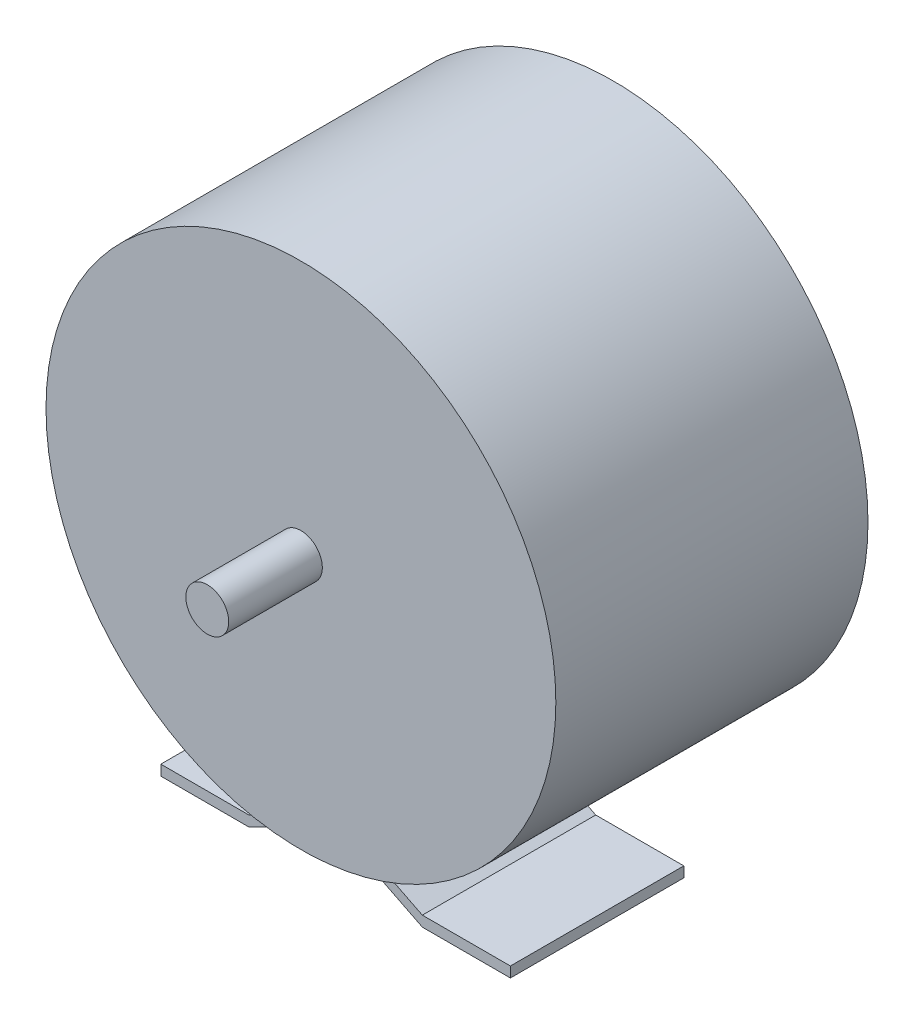
from build123d import *

# Parameters (mm, degrees)
SKETCH1_R           = 73.5
BOSS_EXTRUDE1_DEPTH = 90
SKETCH2_R           = 6.175
BOSS_EXTRUDE2_DEPTH = 27
BOSS_EXTRUDE3_DEPTH = 50
SHELL1_START        = 8
SHELL1_OUTLINE_R    = 65.5
SHELL1_DEPTH        = 74


# Read off the part's stored shape, not the designer's step: Shell1
with BuildPart() as part:
    # Sketch1 → Boss-Extrude1 (new body)
    with BuildSketch(Plane.XY):
        with Locations(Location((0, 0, 0), (0, 0, 180))):
            Circle(SKETCH1_R)
    extrude(amount=BOSS_EXTRUDE1_DEPTH)

    # Sketch2 → Boss-Extrude2 (add)
    with BuildSketch(Plane.XY.offset(90)):
        Circle(SKETCH2_R)
    extrude(amount=BOSS_EXTRUDE2_DEPTH)

    # Sketch3 → Boss-Extrude3 (add)
    with BuildSketch(Plane.XY.offset(80)):
        Polygon((-50.4, -85.345), (-25, -85.345), (-6.35, -76), (0, -76), (0, -73), (-6.35, -73), (-25, -82.345), (-50.4, -82.345), align=None)
    boss_extrude3 = extrude(amount=-BOSS_EXTRUDE3_DEPTH)

    # Mirror1: Boss-Extrude3 across plane
    add(boss_extrude3.mirror(Plane(origin=(0, 0, 0), x_dir=(0, 0, 1), z_dir=(1, 0, 0))))

    # Shell1 outline → Shell1 (cut)
    with BuildSketch(Plane.XY.offset(SHELL1_START)):
        Circle(SHELL1_OUTLINE_R)
    extrude(amount=SHELL1_DEPTH, mode=Mode.SUBTRACT)


solid = part.part
